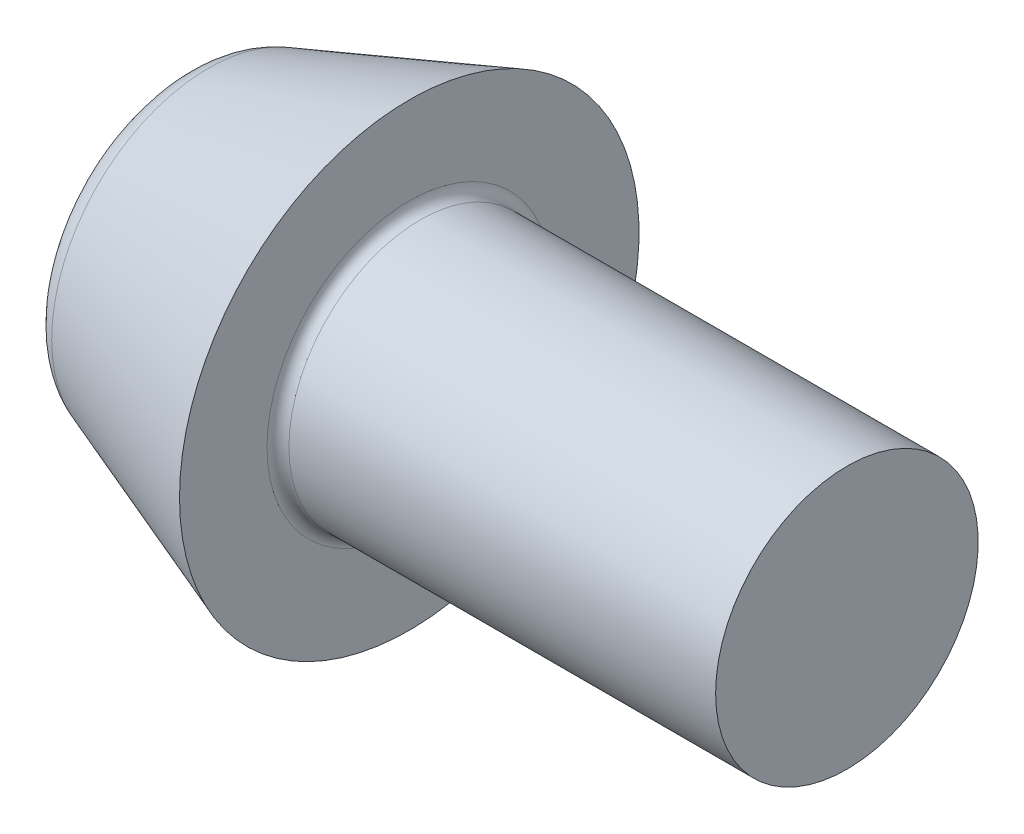
from build123d import *

# Parameters (mm, degrees)
FILLET1_R = 0.5
FILLET2_R = 2


with BuildPart() as part:
    # Sketch1 → Base-Revolve (revolve)
    with BuildSketch(Plane.XY):
        Polygon((0, 0), (30.5, 0), (30.5, 6), (10.5, 6), (10.5, 10.5), (0, 6.67831254), align=None)
    revolve(axis=Axis((-26.488571429, 0, 0), (1, 0, 0)))

    # Fillet1
    fillet1_edges = [part.edges().sort_by_distance(p)[0] for p in [
        (10.5, -6, 0),
    ]]
    fillet(fillet1_edges, radius=FILLET1_R)

    # Fillet2
    fillet2_edges = [part.edges().sort_by_distance(p)[0] for p in [
        (0, -6.67831254, 0),
    ]]
    fillet(fillet2_edges, radius=FILLET2_R)


solid = part.part
